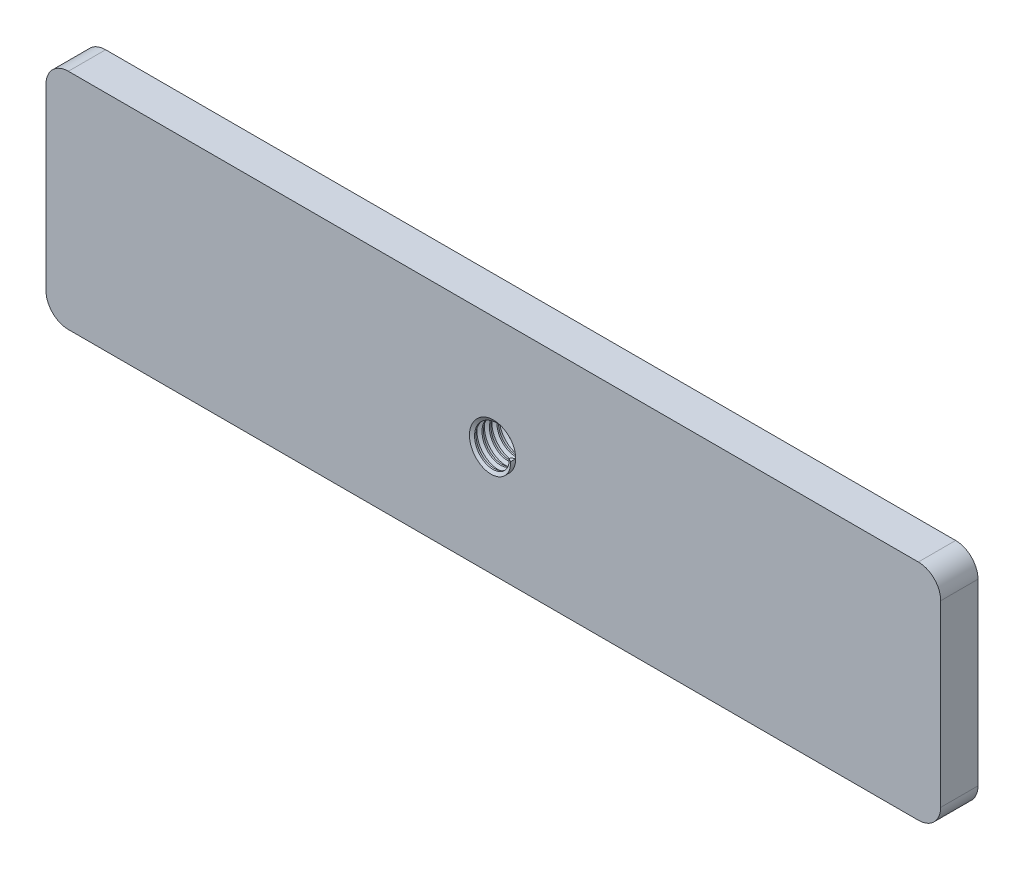
from build123d import *

# Parameters (mm, degrees)
SKETCH2_R           = 3
BOSS_EXTRUDE1_DEPTH = 5
THREAD1_PITCH       = 1


with BuildPart() as part:
    # Sketch2 → Boss-Extrude1 (new body)
    with BuildSketch(Plane.XY):
        with BuildLine():
            Line((-57, -15), (57, -15))
            ThreePointArc((57, -15), (59.121320344, -14.121320344), (60, -12))
            Line((60, -12), (60, 12))
            ThreePointArc((60, 12), (59.121320344, 14.121320344), (57, 15))
            Line((57, 15), (-57, 15))
            ThreePointArc((-57, 15), (-59.121320344, 14.121320344), (-60, 12))
            Line((-60, 12), (-60, -12))
            ThreePointArc((-60, -12), (-59.121320344, -14.121320344), (-57, -15))
        make_face()
        Circle(SKETCH2_R, mode=Mode.SUBTRACT)
    extrude(amount=BOSS_EXTRUDE1_DEPTH)

    # Thread1: the profile of Thread Profile2 profile screwed along a right-hand helix of 5 turns, 8 arcs to a turn; built about Z, then put on its axis
    thread1_z = Axis((0, 0, 0), (0, 0, 1))
    thread1_corners = [(3.0003, 0, -0.000173205), (3.0003, 0, 0.700173203), (2.5669873, 0, 0.449999999), (2.5669873, 0, 0.249999999)]
    with BuildLine(mode=Mode.PRIVATE) as thread1_profile:
        Line(thread1_corners[0], thread1_corners[1])
        Line(thread1_corners[1], thread1_corners[2])
        Line(thread1_corners[2], thread1_corners[3])
        Line(thread1_corners[3], thread1_corners[0])
    thread1_cap = Face(thread1_profile.wire())
    thread1_turn_angles = [0, 22.5, 45, 67.5, 90, 112.5, 135, 157.5, 180, 202.5, 225, 247.5, 270, 292.5, 315, 337.5, 360]
    thread1_turn_weights = [1, 0.9238795325112867, 1, 0.9238795325112867, 1, 0.9238795325112867, 1, 0.9238795325112867, 1, 0.9238795325112867, 1, 0.9238795325112867, 1, 0.9238795325112867, 1, 0.9238795325112867, 1]
    thread1_turn_rails = [Edge.make_bspline([Vector(p[0], p[1], 0).rotate(thread1_z, thread1_turn_angles[k]) / thread1_turn_weights[k] + Vector(0, 0, p[2] + THREAD1_PITCH * thread1_turn_angles[k] / 360) for k in range(17)], [0, 0, 0, 1, 1, 2, 2, 3, 3, 4, 4, 5, 5, 6, 6, 7, 7, 8, 8, 8], 2, thread1_turn_weights) for p in thread1_corners]
    thread1_turn_sides = [Face.make_surface_from_curves(thread1_turn_rails[p[0]], thread1_turn_rails[p[1]]) for p in [(0, 1), (1, 2), (2, 3), (3, 0)]]
    thread1 = Plane(origin=(0, 0, 0), x_dir=(1, 0, 0), z_dir=(0, 0, 1)) * Solid(Shell([*[p.moved(Location((0, 0, THREAD1_PITCH * i))) for i in range(5) for p in thread1_turn_sides], thread1_cap, thread1_cap.rotate(thread1_z, 1800).moved(Location((0, 0, THREAD1_PITCH * 1800 / 360)))]))
    add(thread1)


solid = part.part
